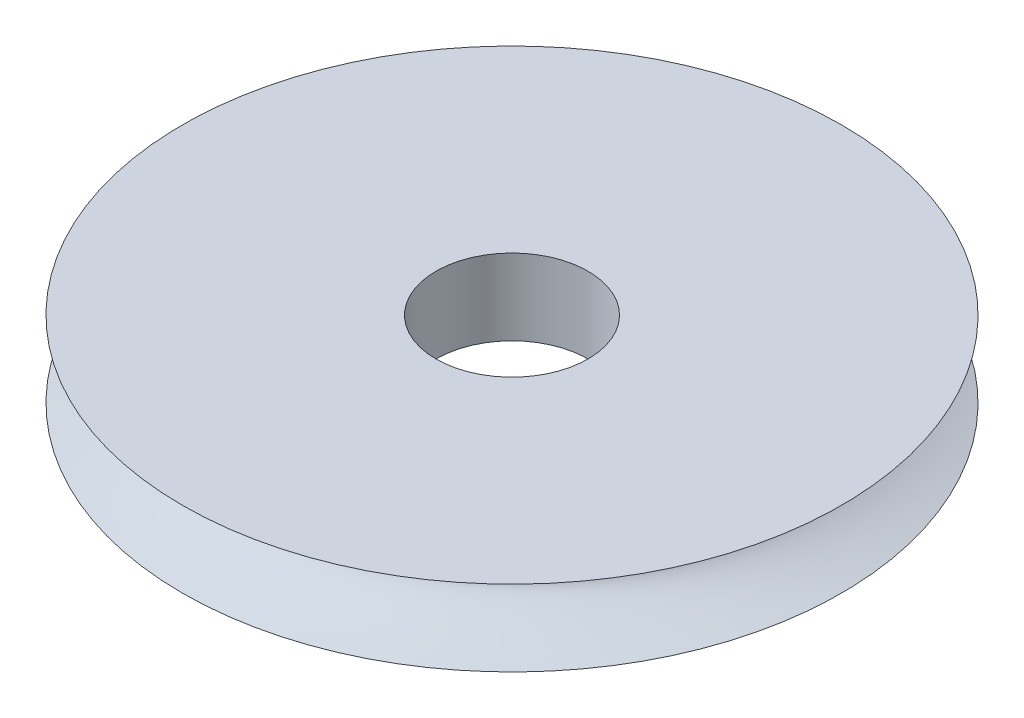
from build123d import *

# Parameters (mm, degrees)
SKETCH117_R                   = 3
CUT_EXTRUDE4_DEPTH            = 3
M2X0_4_START                  = -5.931289347
M2X0_4_TAPPED_HOLE1_OUTLINE_R = 0.8
M2X0_4_TAPPED_HOLE1_DEPTH     = 8.484952251


# Read off the part's stored shape, not the designer's step: M2x0.4 Tapped Hole1
with BuildPart() as part:
    # Sketch9 → Revolve1 (revolve)
    with BuildSketch(Plane.XY):
        with BuildLine():
            Line((-4.703089141, -2.935363462), (8.296910859, -2.935363462))
            Line((8.296910859, -2.935363462), (8.296910859, 0.064636538))
            Line((8.296910859, 0.064636538), (-4.703089141, 0.064636538))
            add(Edge.make_bspline(
                [(-4.703089141, 0.064636538), (0.132127885, -1.294166307), (-4.703089141, -2.935363462)],
                knots=[0, 0, 0, 1, 1, 1], degree=2))
        make_face()
    revolve(axis=Axis((8.296910859, -2.935363462, 0), (0, 1, 0)))

    # Sketch117 → Cut-Extrude4 (cut)
    with BuildSketch(Plane(origin=(0, 0.064636538, 0), x_dir=(1, 0, 0), z_dir=(0, 1, 0))):
        with Locations(Location((8.29691086, 0, 0), (0, 0, 270))):
            Circle(SKETCH117_R)
    extrude(amount=-CUT_EXTRUDE4_DEPTH, mode=Mode.SUBTRACT)

    # M2x0.4 Tapped Hole1 outline → M2x0.4 Tapped Hole1 (cut)
    with BuildSketch(Plane(origin=(0, 0, 0), x_dir=(0.7627522743476953, 0.03658875504667491, 0.6456548853540508), z_dir=(0.6466907823507446, -0.04315533310364318, -0.7615304650815327)).offset(M2X0_4_START)):
        with Locations((6.261089871, 1.839084068)):
            Circle(M2X0_4_TAPPED_HOLE1_OUTLINE_R)
    extrude(amount=M2X0_4_TAPPED_HOLE1_DEPTH, mode=Mode.SUBTRACT)


solid = part.part
